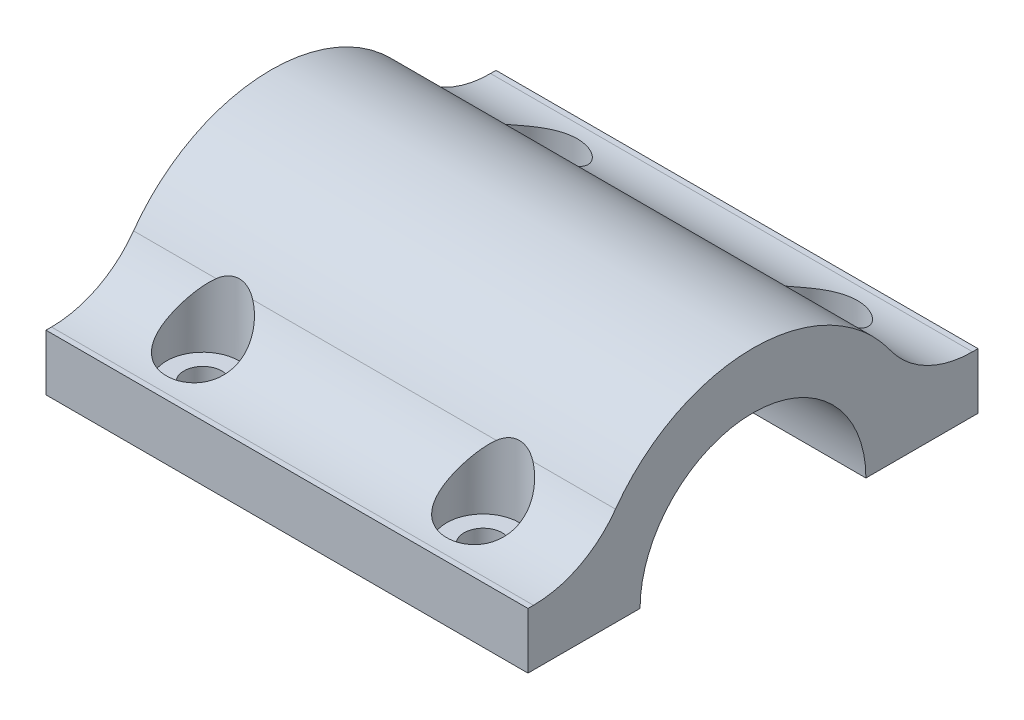
from build123d import *
from build123d.topology import SkipClean

# Parameters (mm, degrees)
BOSS_EXTRUDE1_DEPTH           = 21.5
CBORE_FOR_M3_SHCS1_AT_2_COUNT = 2
CBORE_FOR_M3_SHCS1_AT_2_PITCH = 25
FILLET1_START                 = -21.5
FILLET1_DEPTH                 = 43
FILLET1_START_2               = 5
FILLET1_2_OUTLINE_R           = 3.25
FILLET1_2_DEPTH               = 4.350124689


with BuildPart() as part:
    # Sketch1 → Boss-Extrude1 (new, symmetric)
    with BuildSketch(Plane(origin=(0, 0, 0), x_dir=(0, 0, -1), z_dir=(1, 0, 0))):
        with BuildLine():
            Line((-10.075, 0), (-20.075, 0))
            Line((-20.075, 0), (-20.075, 5))
            Line((-20.075, 5), (-14.221660416, 5))
            ThreePointArc((-14.221660416, 5), (0, 15.075), (14.221660416, 5))
            Line((14.221660416, 5), (20.075, 5))
            Line((20.075, 5), (20.075, 0))
            Line((20.075, 0), (10.075, 0))
            ThreePointArc((10.075, 0), (0, 10.075), (-10.075, 0))
        make_face()
    extrude(amount=BOSS_EXTRUDE1_DEPTH, both=True)

    # Sketch4 → CBORE for M3 SHCS1 (revolve, cut)
    with BuildSketch(Plane(origin=(12.5, 0, 15.075), x_dir=(0, 0, -1), z_dir=(1, 0, 0))):
        Polygon((0, 0), (0, 15.075), (3.25, 15.075), (3.25, 3), (1.7, 3), (1.7, 0), align=None)
    cbore_for_m3_shcs1 = revolve(axis=Axis((12.5, -6.35, 15.075), (0, 1, 0)), mode=Mode.SUBTRACT)

    # CBORE for M3 SHCS1 at 2: CBORE for M3 SHCS1 ×2
    with Locations(*[(-i * CBORE_FOR_M3_SHCS1_AT_2_PITCH, 0, 0) for i in range(1, CBORE_FOR_M3_SHCS1_AT_2_COUNT)]):
        add(cbore_for_m3_shcs1, mode=Mode.SUBTRACT)

    # Mirror1: CBORE for M3 SHCS1 across plane
    add(cbore_for_m3_shcs1.mirror(Plane.XY), mode=Mode.SUBTRACT)

    # Mirror1 copy 1 sketch → Mirror1 copy 1 (revolve, cut)
    with BuildSketch(Plane(origin=(-12.5, 0, -15.075), x_dir=(0, 0, 1), z_dir=(1, 0, 0))):
        Polygon((0, 0), (0, -15.075), (3.25, -15.075), (3.25, -3), (1.7, -3), (1.7, 0), align=None)
    revolve(axis=Axis((-12.5, -6.35, -15.075), (0, -1, 0)), mode=Mode.SUBTRACT)

    # Fillet1: read off the stored shape, not the designer's step
    # Fillet1 outline → Fillet1 (add)
    with BuildSketch(Plane.YZ.offset(FILLET1_START)):
        with BuildLine():
            Line((5, -14.221660416), (5, -19.585852675))
            ThreePointArc((5, -19.585852675), (5.996788028, -15.468985161), (8.76635514, -12.264038591))
            ThreePointArc((8.76635514, -12.264038591), (6.952424344, -13.376076433), (5, -14.221660416))
        make_face()
        with BuildLine():
            ThreePointArc((5, 14.221660416), (6.952424344, 13.376076433), (8.76635514, 12.264038591))
            ThreePointArc((8.76635514, 12.264038591), (5.996788028, 15.468985161), (5, 19.585852675))
            Line((5, 19.585852675), (5, 14.221660416))
        make_face()
    extrude(amount=FILLET1_DEPTH)

    # Fillet1 2 outline → Fillet1 2 (cut)
    with SkipClean():  # the faces are left unmerged after this step: merging them gives an invalid solid
        with BuildSketch(Plane(origin=(0, 0, 0), x_dir=(1, 0, 0), z_dir=(0, 1, 0)).offset(FILLET1_START_2)):
            with Locations((12.5, 15.075)):
                Circle(FILLET1_2_OUTLINE_R)
            with Locations((-12.5, 15.075)):
                Circle(FILLET1_2_OUTLINE_R)
            with Locations((12.5, -15.075)):
                Circle(FILLET1_2_OUTLINE_R)
            with Locations((-12.5, -15.075)):
                Circle(FILLET1_2_OUTLINE_R)
        extrude(amount=FILLET1_2_DEPTH, mode=Mode.SUBTRACT)


solid = part.part
